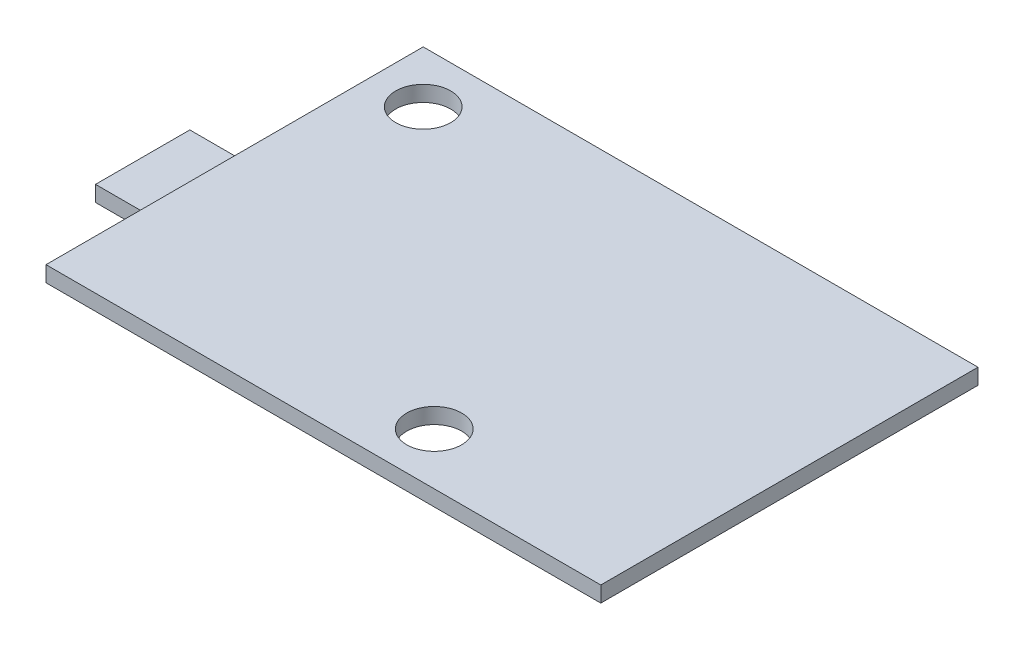
from build123d import *

# Parameters (mm, degrees)
SKETCH1_W                  = 35.3
SKETCH1_H                  = 24
BOSS_EXTRUDE1_DEPTH        = 1
F_3_5_3_5_DIAMETER_HOLE1_D = 3.5
SKETCH5_W                  = 1
SKETCH5_H                  = 6
BOSS_EXTRUDE2_DEPTH        = 2
SKETCH6_W                  = 6
SKETCH6_H                  = 1
BOSS_EXTRUDE3_DEPTH        = 22
FILLET1_R                  = 1
FILLET2_R                  = 2


with BuildPart() as part:
    # Sketch1 → Boss-Extrude1 (new body)
    with BuildSketch(Plane(origin=(0, 0, 0), x_dir=(1, 0, 0), z_dir=(0, 1, 0))):
        Rectangle(SKETCH1_W, SKETCH1_H)
    extrude(amount=BOSS_EXTRUDE1_DEPTH)

    # Ø3.5 (3.5) Diameter Hole1 (through all)
    with Locations(Plane(origin=(0, 1, 0), x_dir=(1, 0, 0), z_dir=(0, 1, 0))):
        with Locations((-14.35, 8.7), (3.75, -8.7)):
            Hole(F_3_5_3_5_DIAMETER_HOLE1_D / 2)

    # Sketch5 → Boss-Extrude2 (add)
    with BuildSketch(Plane.XZ):
        with Locations((0, 1)):
            Rectangle(SKETCH5_W, SKETCH5_H)
    extrude(amount=BOSS_EXTRUDE2_DEPTH)

    # Sketch6 → Boss-Extrude3 (add)
    with BuildSketch(Plane.ZY.offset(0.5)):
        with Locations((1, -1.5)):
            Rectangle(SKETCH6_W, SKETCH6_H)
    extrude(amount=BOSS_EXTRUDE3_DEPTH)

    # Fillet1
    fillet1_edges = [part.edges().sort_by_distance(p)[0] for p in [
        (-0.5, -1, 1),
    ]]
    fillet(fillet1_edges, radius=FILLET1_R - 0.0001)  # a hair under: the kernel refuses the full size

    # Fillet2
    fillet2_edges = [part.edges().sort_by_distance(p)[0] for p in [
        (0.5, -2, 1),
    ]]
    fillet(fillet2_edges, radius=FILLET2_R - 0.0001)  # a hair under: the kernel refuses the full size


solid = part.part
